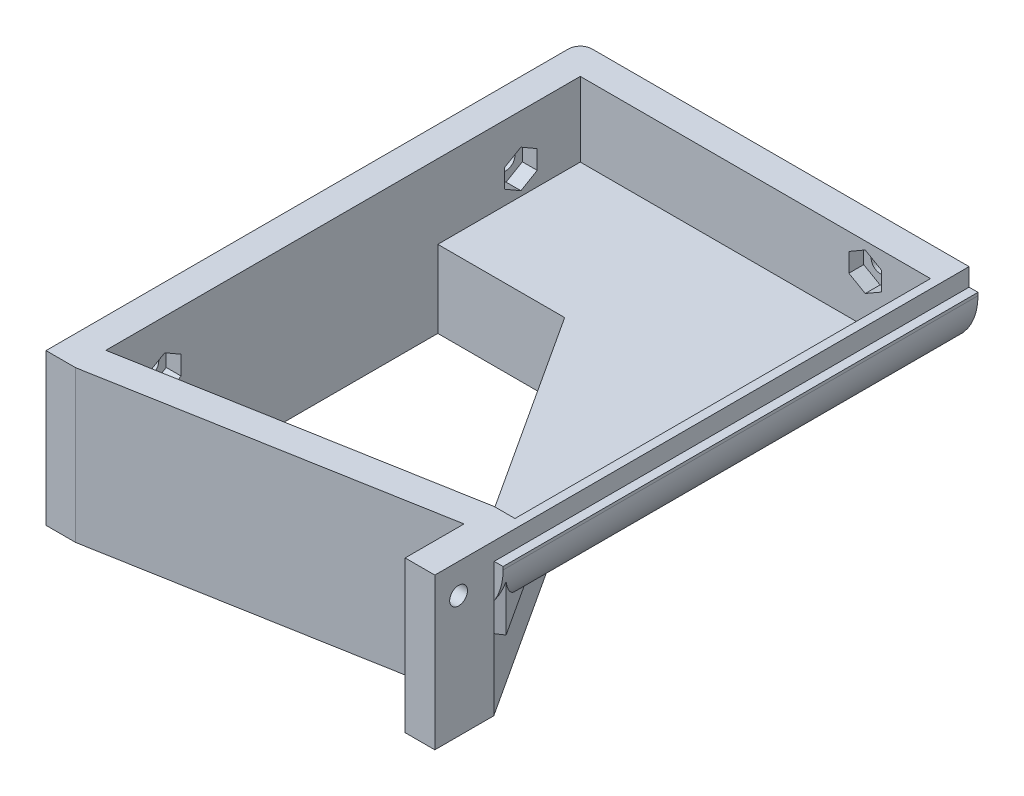
from build123d import *

# Parameters (mm, degrees)
ESQUISSE1_W              = 65.5
ESQUISSE1_H              = 90
BOSS_EXTRU_1_DEPTH       = 25.5
CONG_2_R                 = 2
ESQUISSE6_W              = 80
ESQUISSE6_H              = 22.5
BOSS_EXTRU_2_DEPTH       = 1.5
ENL_V_MAT_EXTRU_5_DEPTH  = 12
COQUE1_DEPTH             = 25.5
COQUE1_START             = 13
COQUE1_2_DEPTH           = 12.5
COQUE1_3_OUTLINE_W       = 3.5
COQUE1_3_OUTLINE_H       = 70
COQUE1_3_DEPTH           = 4.5
ENL_V_MAT_EXTRU_12_DEPTH = 12.5
CONG_5_R                 = 9
CONG_4_R                 = 10
BOSS_EXTRU_3_REACH       = 115.01
BOSS_EXTRU_3_END_RADIUS  = 10
ESQUISSE5_R              = 1.5
ENL_V_MAT_EXTRU_4_DEPTH  = 8
CONG_3_R                 = 6
ESQUISSE11_R             = 1.5
ENL_V_MAT_EXTRU_7_DEPTH  = 7.5
ESQUISSE12_R             = 1.5
ENL_V_MAT_EXTRU_8_DEPTH  = 7.5
ENL_V_MAT_EXTRU_9_DEPTH  = 2.5
ENL_V_MAT_EXTRU_10_DEPTH = 2.5
ENL_V_MAT_EXTRU_11_DEPTH = 2.5
BOSS_EXTRU_7_START       = -25.5
BOSS_EXTRU_7_DEPTH       = 25.5
ENL_V_MAT_EXTRU_13_DEPTH = 116.061939841
ESQUISSE21_R             = 1.5
ENL_V_MAT_EXTRU_14_DEPTH = 7.5
ENL_V_MAT_EXTRU_15_DEPTH = 2.5


# Read off the part's stored shape, not the designer's step: Coque1
with BuildPart() as part:
    # Esquisse1 → Boss.-Extru.1 (new body)
    with BuildSketch(Plane(origin=(0, 0, 0), x_dir=(1, 0, 0), z_dir=(0, 1, 0))):
        with Locations((32.75, -45)):
            Rectangle(ESQUISSE1_W, ESQUISSE1_H)
    extrude(amount=BOSS_EXTRU_1_DEPTH)

    # Congé2
    cong_2_edges = [part.edges().sort_by_distance(p)[0] for p in [
        (0, 12.75, 0),
    ]]
    fillet(cong_2_edges, radius=CONG_2_R)

    # Esquisse6 → Boss.-Extru.2 (add)
    with BuildSketch(Plane(origin=(65.5, 0, 0), x_dir=(0, 0, -1), z_dir=(1, 0, 0))):
        with Locations((-40, 11.25)):
            Rectangle(ESQUISSE6_W, ESQUISSE6_H)
    extrude(amount=BOSS_EXTRU_2_DEPTH)

    # Esquisse8 → Enlèv. mat.-Extru.5 (cut)
    with BuildSketch(Plane.XZ):
        Polygon((0, 0), (67, 0), (67, 82.382775564), (31.68341261, 28), (0, 28), align=None)
    extrude(amount=-ENL_V_MAT_EXTRU_5_DEPTH, mode=Mode.SUBTRACT)

    # Coque1 outline → Coque1 (cut)
    with BuildSketch(Plane(origin=(0, 0, 0), x_dir=(1, 0, 0), z_dir=(0, 1, 0))):
        Polygon((60.5, -90), (60.5, -81.554045593), (26.371003739, -29), (5, -29), (5, -90), align=None)
    extrude(amount=COQUE1_DEPTH, mode=Mode.SUBTRACT)

    # Coque1 2 outline → Coque1 2 (cut)
    with BuildSketch(Plane(origin=(0, 0, 0), x_dir=(1, 0, 0), z_dir=(0, 1, 0)).offset(COQUE1_START)):
        Polygon((60.5, -81.554045593), (60.5, -5), (5, -5), (5, -29), (26.371003739, -29), align=None)
    extrude(amount=COQUE1_2_DEPTH, mode=Mode.SUBTRACT)

    # Coque1 3 outline → Coque1 3 (cut)
    with BuildSketch(Plane(origin=(0, 0, 0), x_dir=(1, 0, 0), z_dir=(0, 1, 0)).offset(COQUE1_START)):
        with Locations((62.25, -40)):
            Rectangle(COQUE1_3_OUTLINE_W, COQUE1_3_OUTLINE_H)
    extrude(amount=COQUE1_3_DEPTH, mode=Mode.SUBTRACT)

    # Esquisse17 → Enlèv. mat.-Extru.12 (cut)
    with BuildSketch(Plane(origin=(0, 13, 0), x_dir=(1, 0, 0), z_dir=(0, 1, 0))):
        Polygon((5, -5), (5, -29), (26.371003739, -29), (60.5, -81.554045593), (60.5, -75), (64, -75), (64, -5), align=None)
    extrude(amount=ENL_V_MAT_EXTRU_12_DEPTH, mode=Mode.SUBTRACT)

    # Congé5
    cong_5_edges = [part.edges().sort_by_distance(p)[0] for p in [
        (64, 13, 40),
    ]]
    fillet(cong_5_edges, radius=CONG_5_R)

    # Congé4
    cong_4_edges = [part.edges().sort_by_distance(p)[0] for p in [
        (67, 12, 40),
    ]]
    fillet(cong_4_edges, radius=CONG_4_R)

    # Boss.-Extru.3: up to this cylinder (the profile starts outside it)
    boss_extru_3_end = Plane(origin=(57, 22, 72.615279), z_dir=(0, 0, -1)) * Cylinder(BOSS_EXTRU_3_END_RADIUS, 251.02, mode=Mode.PRIVATE)
    # Esquisse9 → Boss.-Extru.3 (add, up to the surface)
    with BuildSketch(Plane.XZ.offset(-12), mode=Mode.PRIVATE) as boss_extru_3_sk1:
        Polygon((57, 66.984125926), (57, 64.230008238), (66.758005852, 79.256019566), (65.5, 80.072978118), align=None)
    boss_extru_3_tool1 = extrude(boss_extru_3_sk1.sketch, amount=-BOSS_EXTRU_3_REACH, mode=Mode.PRIVATE) - boss_extru_3_end
    add(boss_extru_3_tool1.solids().sort_by_distance((61.571725, 12, 72.615279))[0])

    # Esquisse5 → Enlèv. mat.-Extru.4 (cut)
    with BuildSketch(Plane.ZY):
        with Locations((15, 17)):
            Circle(ESQUISSE5_R)
        with Locations((75, 17)):
            Circle(ESQUISSE5_R)
    extrude(amount=-ENL_V_MAT_EXTRU_4_DEPTH, mode=Mode.SUBTRACT)

    # Congé3
    cong_3_edges = [part.edges().sort_by_distance(p)[0] for p in [
        (31.68341261, 6, 28),
    ]]
    fillet(cong_3_edges, radius=CONG_3_R)

    # Esquisse11 → Enlèv. mat.-Extru.7 (cut)
    with BuildSketch(Plane(origin=(9.495472341, 0, -6.166431839), x_dir=(-0.5446390350150254, 0, -0.8386705679454252), z_dir=(0.8386705679454252, 0, -0.5446390350150254))):
        with Locations((-70.828706829, 5.5)):
            Circle(ESQUISSE11_R)
    extrude(amount=-ENL_V_MAT_EXTRU_7_DEPTH, mode=Mode.SUBTRACT)

    # Esquisse12 → Enlèv. mat.-Extru.8 (cut)
    with BuildSketch(Plane(origin=(65.5, 0, 0), x_dir=(0, 0, -1), z_dir=(1, 0, 0))):
        with Locations((-86, 20.5)):
            Circle(ESQUISSE12_R)
    extrude(amount=-ENL_V_MAT_EXTRU_8_DEPTH, mode=Mode.SUBTRACT)

    # Esquisse13 → Enlèv. mat.-Extru.9 (cut)
    with BuildSketch(Plane(origin=(5, 0, 0), x_dir=(0, 0, -1), z_dir=(1, 0, 0))):
        Polygon((-72.25, 18.58771324), (-75, 20.175426481), (-77.75, 18.58771324), (-77.75, 15.41228676), (-75, 13.824573519), (-72.25, 15.41228676), align=None)
        Polygon((-12.25, 18.58771324), (-15, 20.175426481), (-17.75, 18.58771324), (-17.75, 15.41228676), (-15, 13.824573519), (-12.25, 15.41228676), align=None)
    extrude(amount=-ENL_V_MAT_EXTRU_9_DEPTH, mode=Mode.SUBTRACT)

    # Esquisse14 → Enlèv. mat.-Extru.10 (cut)
    with BuildSketch(Plane.ZY.offset(-60.5)):
        Polygon((88.75, 22.08771324), (86, 23.675426481), (83.25, 22.08771324), (83.25, 18.91228676), (86, 17.324573519), (88.75, 18.91228676), align=None)
    extrude(amount=-ENL_V_MAT_EXTRU_10_DEPTH, mode=Mode.SUBTRACT)

    # Esquisse15 → Enlèv. mat.-Extru.11 (cut)
    with BuildSketch(Plane(origin=(5.302119501, 0, -3.443236664), x_dir=(0.5446390350150254, 0, 0.8386705679454252), z_dir=(-0.8386705679454252, 0, 0.5446390350150254))):
        Polygon((73.578706829, 3.91228676), (73.578706829, 7.08771324), (70.828706829, 8.675426481), (68.078706829, 7.08771324), (68.078706829, 3.91228676), (70.828706829, 2.324573519), align=None)
    extrude(amount=-ENL_V_MAT_EXTRU_11_DEPTH, mode=Mode.SUBTRACT)

    # Esquisse18 → Boss.-Extru.7 (add)
    with BuildSketch(Plane(origin=(0, 25.5, 0), x_dir=(1, 0, 0), z_dir=(0, 1, 0)).offset(BOSS_EXTRU_7_START)):
        Polygon((5, -90), (5, -84.920747226), (60.5, -75), (60.5, -80.079252774), align=None)
    extrude(amount=BOSS_EXTRU_7_DEPTH)

    # Esquisse19 → Enlèv. mat.-Extru.13 (cut, through all)
    with BuildSketch(Plane(origin=(0, 25.5, 0), x_dir=(1, 0, 0), z_dir=(0, 1, 0))):
        Polygon((60.5, -81.554045593), (60.5, -80.079252774), (59.641872403, -80.232644972), align=None)
    extrude(amount=-ENL_V_MAT_EXTRU_13_DEPTH, mode=Mode.SUBTRACT)

    # Esquisse21 → Enlèv. mat.-Extru.14 (cut)
    with BuildSketch(Plane(origin=(0, 0, 0), x_dir=(-1, 0, 0), z_dir=(0, 0, -1))):
        with Locations((-53, 21)):
            Circle(ESQUISSE21_R)
    extrude(amount=-ENL_V_MAT_EXTRU_14_DEPTH, mode=Mode.SUBTRACT)

    # Esquisse22 → Enlèv. mat.-Extru.15 (cut)
    with BuildSketch(Plane.XY.offset(5)):
        Polygon((53, 17.824573519), (55.75, 19.41228676), (55.75, 22.58771324), (53, 24.175426481), (50.25, 22.58771324), (50.25, 19.41228676), align=None)
    extrude(amount=-ENL_V_MAT_EXTRU_15_DEPTH, mode=Mode.SUBTRACT)


solid = part.part
